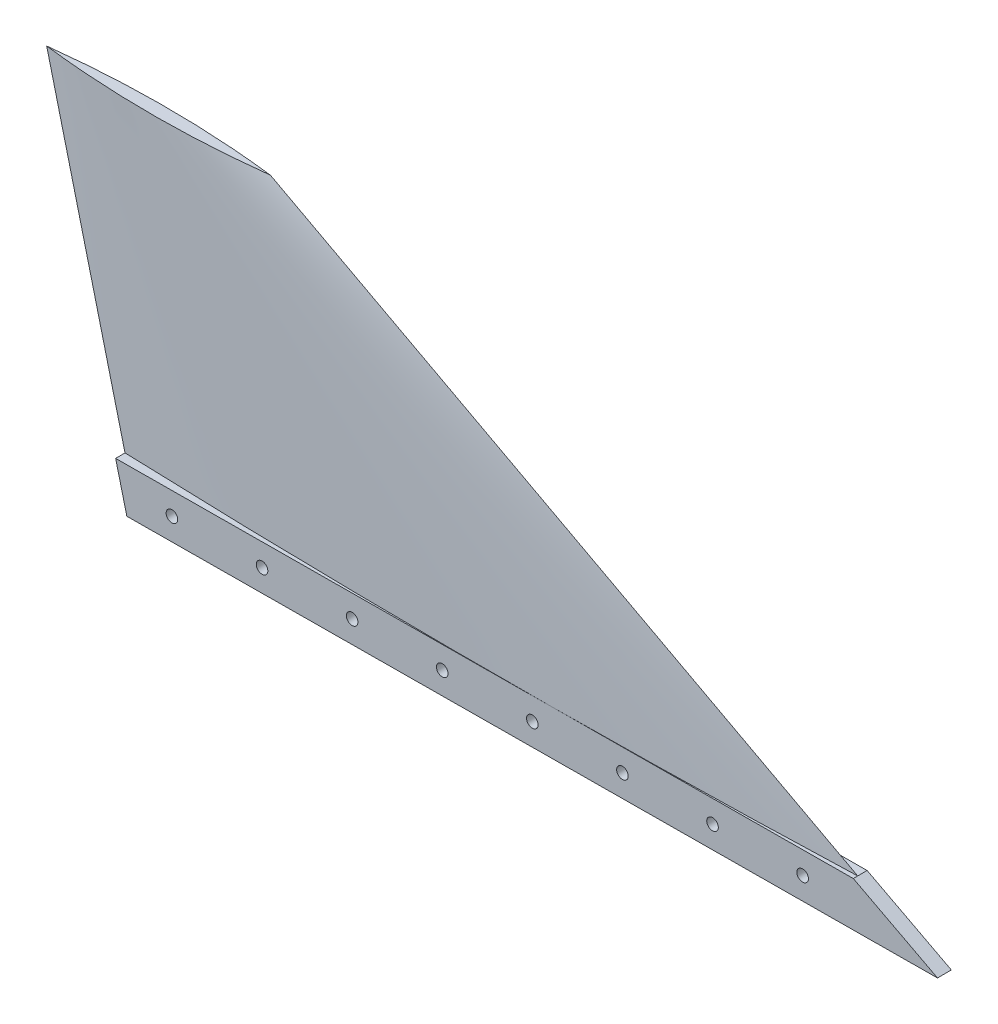
from build123d import *

# Parameters (mm, degrees)
BOSS_EXTRUDE1_DEPTH     = 7.882700516
CUT_EXTRUDE1_DEPTH      = 501.367921145
CUT_EXTRUDE1_DEPTH_BACK = 501.367921145
SKETCH12_W              = 6.35
SKETCH12_H              = 25.4
F_1_4_CLEARANCE_HOLE1_D = 6.5278
LPATTERN1_COUNT         = 8
LPATTERN1_PITCH         = 50.8
SKETCH14_W              = 457.208458034
SKETCH14_H              = 25.4
CUT_EXTRUDE2_DEPTH      = 501.423410323


with BuildPart() as part:
    # Sketch5 for Loft4 → Loft4 section 0
    with BuildSketch(Plane(origin=(0, 203.2, 0), x_dir=(1, 0, 0), z_dir=(0, 1, 0))):
        with BuildLine():
            # circular arc as an exact rational Bezier (weights 1, cos(half-angle), 1)
            Bezier((-50.8, 0), (12.7, 7.647531112), (76.2, 0), weights=[1, 0.992825827, 1])
            Bezier((76.2, 0), (12.7, -7.647531112), (-50.8, 0), weights=[1, 0.992825827, 1])
        make_face()
    # Sketch1 for Loft4 → Loft4 section 1
    with BuildSketch(Plane(origin=(0, 0, 0), x_dir=(1, 0, 0), z_dir=(0, 1, 0))):
        with BuildLine():
            Bezier((0, 0), (228.6, 7.622117255), (457.2, 0), weights=[1, 0.999444599, 1])
            Bezier((457.2, 0), (228.6, -7.622117255), (0, 0), weights=[1, 0.999444599, 1])
        make_face()
    loft()

    # Sketch10 → Boss-Extrude1 (add)
    with BuildSketch(Plane(origin=(-0.017486684, 0, -2.568968528), x_dir=(0, -1, 0), z_dir=(0.006806731520561807, 0, 0.9999768339346702))):
        Polygon((0, 457.189408475), (0, 0), (-25.4, -6.349852895), (-25.4, 409.565511759), align=None)
    extrude(amount=BOSS_EXTRUDE1_DEPTH)

    # Sketch12 → Cut-Extrude1 (cut, two sides: drawn at the far end of the back side and taken through both)
    with BuildSketch(Plane(origin=(0, 0, 0), x_dir=(0.006806731520561808, 0, 0.9999768339346702), z_dir=(-0.9999768339346703, 0, 0.006806731520561808)).offset(-CUT_EXTRUDE1_DEPTH_BACK)):
        with Locations((8.488672474, 12.7)):
            Rectangle(SKETCH12_W, SKETCH12_H)
        with Locations((-5.744028042, 12.7)):
            Rectangle(SKETCH12_W, SKETCH12_H)
    extrude(amount=CUT_EXTRUDE1_DEPTH + CUT_EXTRUDE1_DEPTH_BACK, mode=Mode.SUBTRACT)

    # 1/4 Clearance Hole1 (through all)
    with Locations(Plane(origin=(0.097036893, 0, 14.25568857), x_dir=(0, -1, 0), z_dir=(0.006806731520561807, 0, 0.9999768339346702))):
        with Locations((-12.7, 25.4)):
            f_1_4_clearance_hole1 = Hole(F_1_4_CLEARANCE_HOLE1_D / 2)

    # LPattern1: 1/4 Clearance Hole1 ×8
    with Locations(*[(i * LPATTERN1_PITCH, 0, 0) for i in range(1, LPATTERN1_COUNT)]):
        add(f_1_4_clearance_hole1, mode=Mode.SUBTRACT)

    # Sketch14 → Cut-Extrude2 (cut, through all)
    with BuildSketch(Plane(origin=(0.036168742, 0, 5.313549377), x_dir=(0.9999768339346702, 0, -0.006806731520561792), z_dir=(0.006806731520561792, 0, 0.9999768339346703))):
        with Locations((228.585179458, -12.6238)):
            Rectangle(SKETCH14_W, SKETCH14_H)
    extrude(amount=-CUT_EXTRUDE2_DEPTH, mode=Mode.SUBTRACT)


solid = part.part
